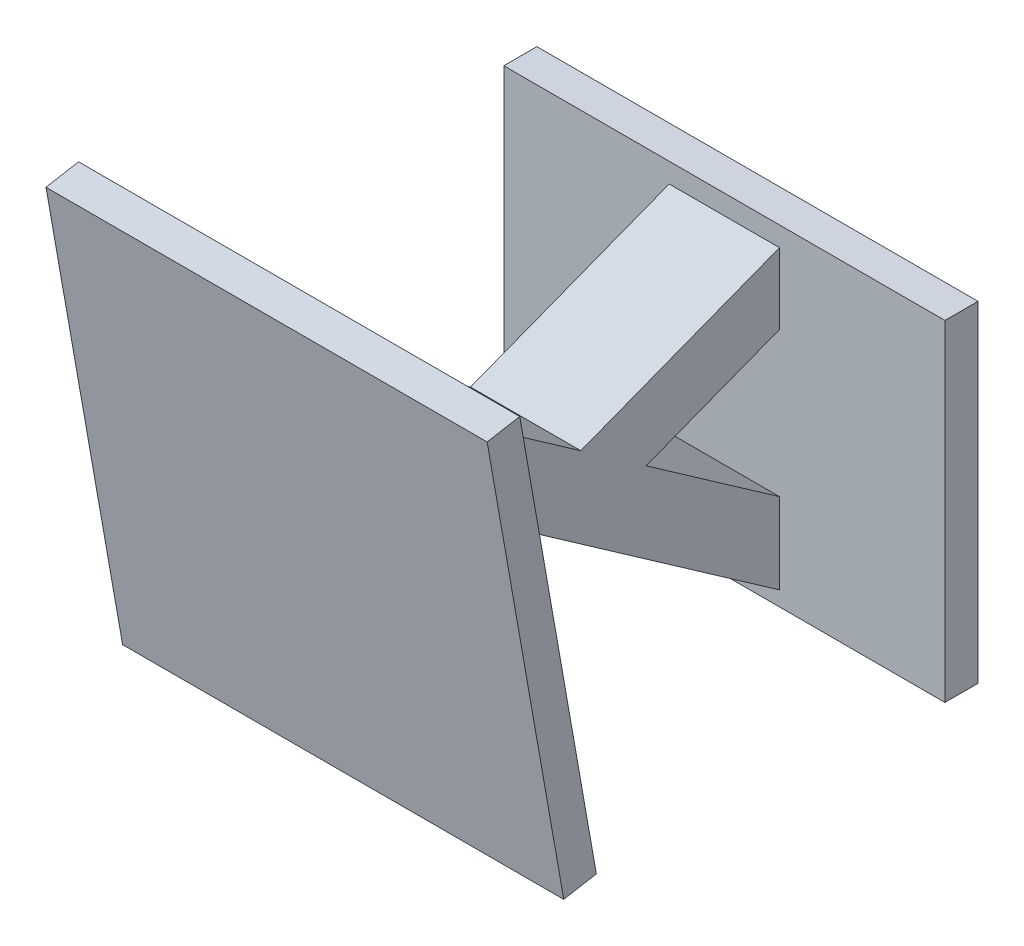
from build123d import *

# Parameters (mm, degrees)
BOSS_EXTRUDE1_DEPTH = 5
SKETCH3_W           = 3
SKETCH3_H           = 30
BOSS_EXTRUDE2_DEPTH = 20


with BuildPart() as part:
    # Sketch2 → Boss-Extrude1 (new, symmetric)
    with BuildSketch(Plane(origin=(0, 0, 0), x_dir=(0, 0, -1), z_dir=(1, 0, 0))):
        Polygon((-3, -98.903535581), (-3, -92.474380652), (-21.018302161, -99.410083352), (-40.334338568, -85.884849051), (-38.860884921, -94.241219935), (-3, -119.351281883), (-3, -112.02663435), (-15.093539832, -103.558646596), align=None)
    extrude(amount=BOSS_EXTRUDE1_DEPTH, both=True)

    # Sketch3 → Boss-Extrude2 (add, symmetric)
    with BuildSketch(Plane(origin=(0, 0, 0), x_dir=(0, 0, -1), z_dir=(1, 0, 0))):
        with Locations((-1.5, -105.688958117)):
            Rectangle(SKETCH3_W, SKETCH3_H)
        Polygon((-34.610334059, -118.34729176), (-41.556261166, -78.95498164), (-44.510684425, -79.475926173), (-37.564757318, -118.868236293), align=None)
    extrude(amount=BOSS_EXTRUDE2_DEPTH, both=True)


solid = part.part
